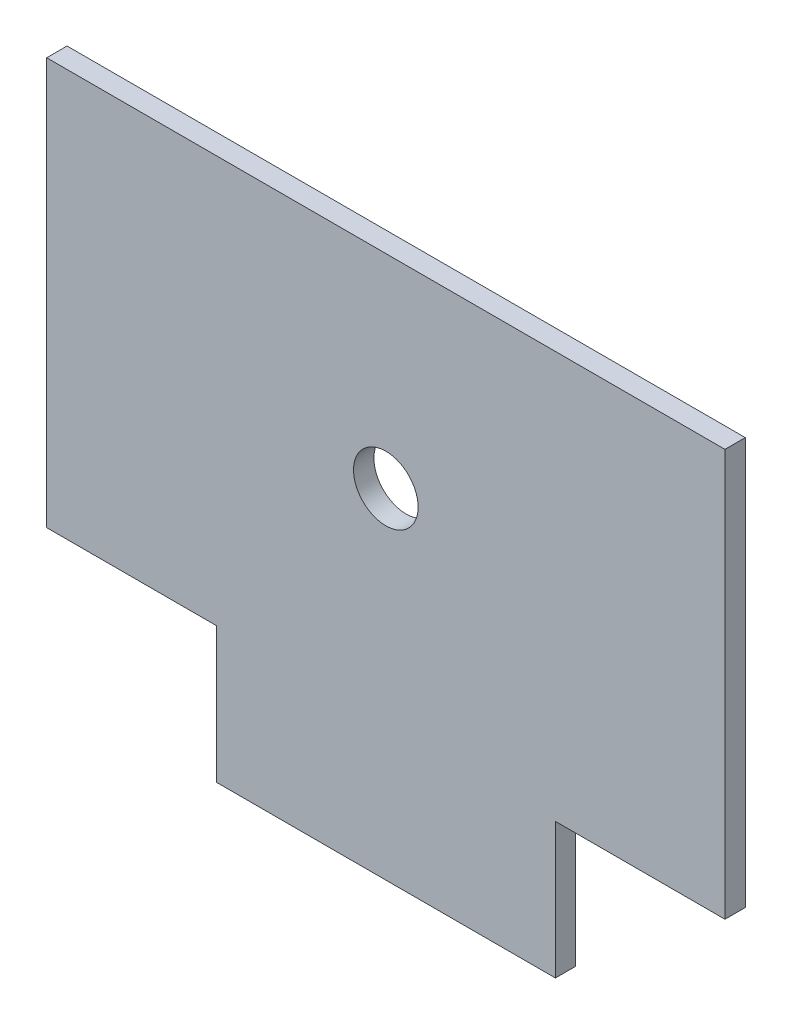
from build123d import *

# Parameters (mm, degrees)
BOSS_EXTRUDE1_DEPTH        = 3
F_3_8_0_3750_DOWEL_HOLE1_D = 9.525


with BuildPart() as part:
    # Sketch1 → Boss-Extrude1 (new body)
    with BuildSketch(Plane.XY):
        Polygon((-50, 0), (-50, -60), (-25, -60), (-25, -80), (25, -80), (25, -60), (50, -60), (50, 0), align=None)
    extrude(amount=BOSS_EXTRUDE1_DEPTH)

    # 3/8 (0.3750) Dowel Hole1 (through all)
    with Locations(Plane.XY.offset(3)):
        with Locations((0, -30)):
            Hole(F_3_8_0_3750_DOWEL_HOLE1_D / 2)


solid = part.part
